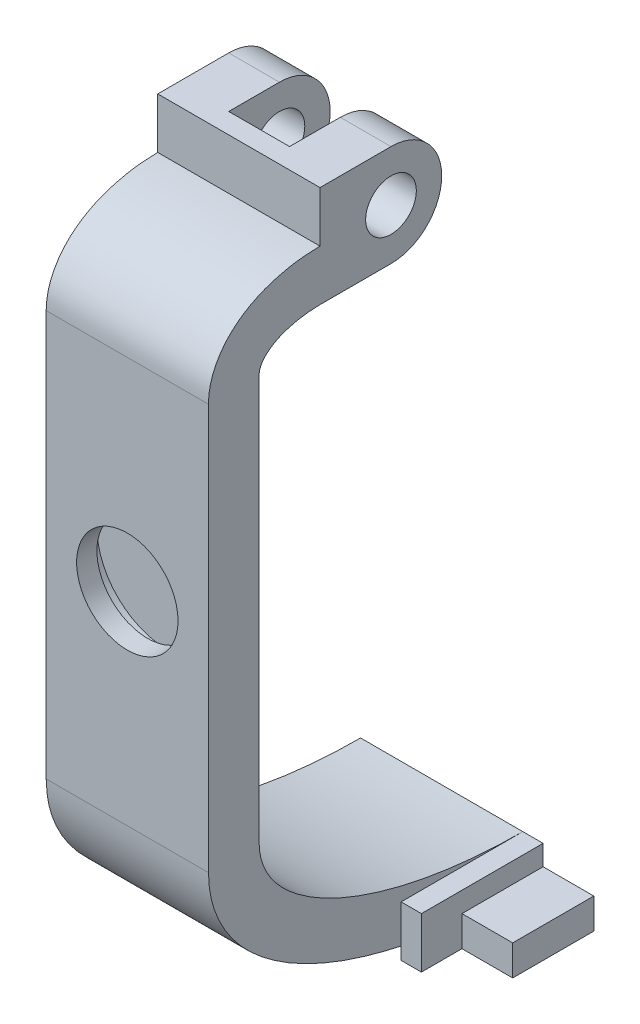
from build123d import *

# Parameters (mm, degrees)
BOSS_EXTRUDE2_DEPTH     = 10
CUT_EXTRUDE1_DEPTH      = 20.104973175
CUT_EXTRUDE1_DEPTH_BACK = 20.104973175
SKETCH3_R               = 2.5
SWEEP2_DEPTH            = 16
SKETCH6_W               = 16
SKETCH6_H               = 5
BOSS_EXTRUDE3_DEPTH     = 40
SWEEP4_DEPTH            = 16
SKETCH11_R              = 5
CUT_EXTRUDE2_DEPTH      = 2
SKETCH13_R              = 7
CUT_EXTRUDE3_DEPTH      = 2
CUT_EXTRUDE4_DEPTH      = 3
FILLET1_R               = 5
SKETCH17_W              = 12
SKETCH17_H              = 5
BOSS_EXTRUDE4_DEPTH     = 2
SKETCH18_W              = 8
SKETCH18_H              = 3
BOSS_EXTRUDE5_DEPTH     = 5


# Read off the part's stored shape, not the designer's step: Sweep2, Sweep4
with BuildPart() as part:
    # Sketch1 → Boss-Extrude2 (new body)
    with BuildSketch(Plane(origin=(0, 0, 0), x_dir=(1, 0, 0), z_dir=(0, 1, 0))):
        Polygon((16, 0), (11, 0), (11, -10), (5, -10), (5, 0), (0, 0), (0, -12), (16, -12), align=None)
    extrude(amount=BOSS_EXTRUDE2_DEPTH)

    # Sketch3 → Cut-Extrude1 (cut, two sides: drawn at the far end of the back side and taken through both)
    with BuildSketch(Plane(origin=(5, 0, 0), x_dir=(0, 0, -1), z_dir=(1, 0, 0)).offset(-CUT_EXTRUDE1_DEPTH_BACK)):
        with Locations((-5, 5)):
            Circle(SKETCH3_R)
    extrude(amount=CUT_EXTRUDE1_DEPTH + CUT_EXTRUDE1_DEPTH_BACK, mode=Mode.SUBTRACT)

    # Sweep2 outline → Sweep2 (add)
    with BuildSketch(Plane.YZ):
        with BuildLine():
            Line((0, 12), (5, 12))
            add(Edge.make_bspline(
                [(5, 12), (4.991277814, 12.688318981), (4.908746061, 14.118877097), (4.494059835, 16.245318685), (3.957732254, 17.750342889), (3.411318321, 18.842891552), (3.001489478, 19.557726126), (2.242511991, 20.561874881), (1.580556332, 21.203692416), (0.928716087, 21.720024552), (0.323591986, 22.133748121), (-0.701392406, 22.614526195), (-1.823238843, 22.935468381), (-2.608908218, 22.983859145), (-3, 23)],
                knots=[0, 0, 0, 0, 0.166666667, 0.333333333, 0.5, 0.5, 0.583333333, 0.666666667, 0.75, 0.75, 0.8125, 0.875, 0.9375, 1, 1, 1, 1], degree=3))
            Line((-3, 23), (-3, 18))
            add(Edge.make_bspline(
                [(0, 12), (0, 12.471404521), (-0.065087382, 13.468133715), (-0.357980601, 14.963227506), (-0.683417511, 15.852116395), (-0.976310729, 16.437902833), (-1.185341525, 16.80000901), (-1.529633622, 17.249552677), (-1.772618921, 17.481263886), (-1.988038584, 17.651829247), (-2.174202639, 17.777587461), (-2.454251279, 17.908151493), (-2.731349145, 17.983890946), (-2.911611652, 18), (-3, 18)],
                knots=[0, 0, 0, 0, 0.166666667, 0.333333333, 0.5, 0.5, 0.583333333, 0.666666667, 0.75, 0.75, 0.8125, 0.875, 0.9375, 1, 1, 1, 1], degree=3))
        make_face()
    extrude(amount=SWEEP2_DEPTH)

    # Sketch6 → Boss-Extrude3 (add)
    with BuildSketch(Plane.XZ.offset(3)):
        with Locations((8, 20.5)):
            Rectangle(SKETCH6_W, SKETCH6_H)
    extrude(amount=BOSS_EXTRUDE3_DEPTH)

    # Sweep4 outline → Sweep4 (add)
    with BuildSketch(Plane.YZ):
        with BuildLine():
            add(Edge.make_bspline(
                [(-43, 18), (-43.353553391, 18), (-44.07460342, 17.930194099), (-45.182994884, 17.601989805), (-46.303189443, 17.036212331), (-47.047845664, 16.491260068), (-47.909524316, 15.752143507), (-48.881465514, 14.748061599), (-50.258633898, 12.800039043), (-51.094757082, 11.230912276), (-52.266329958, 8.69250438), (-53.267394144, 5.796111577), (-53.962527772, 2.637302685), (-54.352391453, 0.503622212), (-54.828170089, -2.731995713), (-55, -5.957247077), (-55, -8)],
                knots=[0, 0, 0, 0, 0.0625, 0.125, 0.1875, 0.25, 0.25, 0.333333333, 0.416666667, 0.5, 0.5, 0.666666667, 0.75, 0.75, 0.833333333, 1, 1, 1, 1], degree=3))
            Line((-43, 18), (-43, 23))
            add(Edge.make_bspline(
                [(-43, 23), (-43.681450726, 22.980975055), (-45.058295426, 22.873119263), (-47.066050979, 22.260765234), (-48.956424122, 21.301498195), (-50.119260314, 20.44421056), (-51.410038967, 19.336819996), (-52.782815769, 17.905936964), (-54.54234243, 15.403608104), (-55.559709648, 13.48696901), (-56.955815594, 10.466263575), (-58.086746894, 7.16551514), (-58.86004663, 3.650567343), (-59.291844345, 1.290053693), (-59.815258978, -2.269924856), (-59.994835555, -5.772418734), (-60, -8)],
                knots=[0, 0, 0, 0, 0.0625, 0.125, 0.1875, 0.25, 0.25, 0.333333333, 0.416666667, 0.5, 0.5, 0.666666667, 0.75, 0.75, 0.833333333, 1, 1, 1, 1], degree=3))
            Line((-60, -8), (-55, -8))
        make_face()
    extrude(amount=SWEEP4_DEPTH)

    # Sketch11 → Cut-Extrude2 (cut)
    with BuildSketch(Plane.XY.offset(23)):
        with Locations((8, -23)):
            Circle(SKETCH11_R)
    extrude(amount=-CUT_EXTRUDE2_DEPTH, mode=Mode.SUBTRACT)

    # Sketch13 → Cut-Extrude3 (cut)
    with BuildSketch(Plane.XY.offset(21)):
        with Locations((8, -23)):
            Circle(SKETCH13_R)
    extrude(amount=-CUT_EXTRUDE3_DEPTH, mode=Mode.SUBTRACT)

    # 3DSketch1 → Cut-Extrude4 (cut)
    with BuildSketch(Plane(origin=(0, -60, -8), x_dir=(0.8479983040050881, 0, 0.52999894000318), z_dir=(0, 1, 0))):
        Polygon((0, 0), (13.567972864, 8.47998304), (18.867962264, 0), (5.2999894, -8.47998304), align=None)
    extrude(amount=CUT_EXTRUDE4_DEPTH, mode=Mode.SUBTRACT)

    # Fillet1
    fillet1_edges = [part.edges().sort_by_distance(p)[0] for p in [
        (13.5, 0, 0),
        (13.5, 10, 0),
        (2.5, 0, 0),
        (2.5, 10, 0),
    ]]
    fillet(fillet1_edges, radius=FILLET1_R - 0.0001)  # a hair under: the kernel refuses the full size

    # Sketch17 → Boss-Extrude4 (add)
    with BuildSketch(Plane(origin=(16, 0, 0), x_dir=(0, 0, -1), z_dir=(1, 0, 0))):
        with Locations((2, -57.5)):
            Rectangle(SKETCH17_W, SKETCH17_H)
    extrude(amount=BOSS_EXTRUDE4_DEPTH)

    # Sketch18 → Boss-Extrude5 (add)
    with BuildSketch(Plane(origin=(18, 0, 0), x_dir=(0, 0, -1), z_dir=(1, 0, 0))):
        with Locations((4, -58.5)):
            Rectangle(SKETCH18_W, SKETCH18_H)
    extrude(amount=BOSS_EXTRUDE5_DEPTH)


solid = part.part
